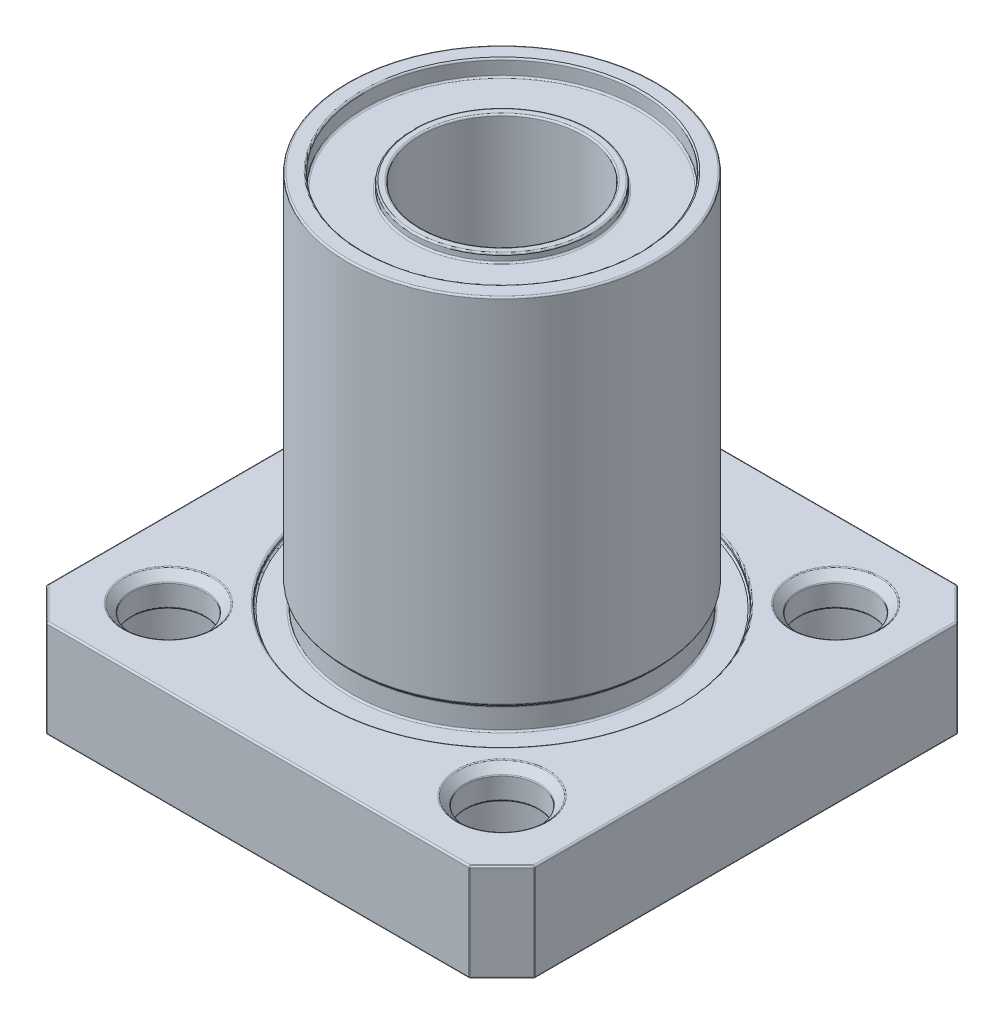
from build123d import *

# Parameters (mm, degrees)
SKETCH1_W           = 30
SKETCH1_H           = 30
BOSS_EXTRUDE1_DEPTH = 6
SKETCH2_R           = 9.5
BOSS_EXTRUDE2_DEPTH = 23
CUT_EXTRUDE3_REACH  = 33.289
SKETCH3_R           = 2.25
CHAMFER2_SIZE       = 2
SKETCH6_R           = 8.5
CUT_EXTRUDE4_DEPTH  = 36.930488446
CUT_EXTRUDE6_START  = -0.3
SKETCH7_R           = 10.8
SKETCH7_R_2         = 9.5
CUT_EXTRUDE6_DEPTH  = 0.3
SKETCH9_R           = 8.5
SKETCH9_R_2         = 5
BOSS_EXTRUDE3_DEPTH = 27
BOSS_EXTRUDE4_START = 0.5
SKETCH10_R          = 5.5
SKETCH10_R_2        = 5
BOSS_EXTRUDE4_DEPTH = 0.5
CHAMFER3_SIZE       = 0.5
SKETCH12_R          = 3.75
CUT_EXTRUDE7_DEPTH  = 4.1
FILLET2_R           = 0.1
CHAMFER4_SIZE       = 0.5


with BuildPart() as part:
    # Sketch1 → Boss-Extrude1 (new body)
    with BuildSketch(Plane(origin=(0, 0, 0), x_dir=(1, 0, 0), z_dir=(0, 1, 0))):
        Rectangle(SKETCH1_W, SKETCH1_H)
    extrude(amount=BOSS_EXTRUDE1_DEPTH)

    # Sketch2 → Boss-Extrude2 (add)
    with BuildSketch(Plane(origin=(0, 6, 0), x_dir=(1, 0, 0), z_dir=(0, 1, 0))):
        Circle(SKETCH2_R)
    extrude(amount=BOSS_EXTRUDE2_DEPTH)

    # Sketch3 → Cut-Extrude3 (cut, up to next)
    with BuildSketch(Plane(origin=(0, 6, 0), x_dir=(1, 0, 0), z_dir=(0, 1, 0)), mode=Mode.PRIVATE) as cut_extrude3_sk1:
        with Locations((-10.253048327, 10.253048327)):
            Circle(SKETCH3_R)
    cut_extrude3_tool1 = extrude(cut_extrude3_sk1.sketch, amount=-CUT_EXTRUDE3_REACH, mode=Mode.PRIVATE) & part.part
    # Sketch3 → Cut-Extrude3 (cut, up to next)
    with BuildSketch(Plane(origin=(0, 6, 0), x_dir=(1, 0, 0), z_dir=(0, 1, 0)), mode=Mode.PRIVATE) as cut_extrude3_sk2:
        with Locations((10.253048327, 10.253048327)):
            Circle(SKETCH3_R)
    cut_extrude3_tool2 = extrude(cut_extrude3_sk2.sketch, amount=-CUT_EXTRUDE3_REACH, mode=Mode.PRIVATE) & part.part
    # Sketch3 → Cut-Extrude3 (cut, up to next)
    with BuildSketch(Plane(origin=(0, 6, 0), x_dir=(1, 0, 0), z_dir=(0, 1, 0)), mode=Mode.PRIVATE) as cut_extrude3_sk3:
        with Locations((10.253048327, -10.253048327)):
            Circle(SKETCH3_R)
    cut_extrude3_tool3 = extrude(cut_extrude3_sk3.sketch, amount=-CUT_EXTRUDE3_REACH, mode=Mode.PRIVATE) & part.part
    # Sketch3 → Cut-Extrude3 (cut, up to next)
    with BuildSketch(Plane(origin=(0, 6, 0), x_dir=(1, 0, 0), z_dir=(0, 1, 0)), mode=Mode.PRIVATE) as cut_extrude3_sk4:
        with Locations((-10.253048327, -10.253048327)):
            Circle(SKETCH3_R)
    cut_extrude3_tool4 = extrude(cut_extrude3_sk4.sketch, amount=-CUT_EXTRUDE3_REACH, mode=Mode.PRIVATE) & part.part
    add(cut_extrude3_tool1.solids().sort_by_distance((-10.253048, 6, -10.253048))[0], mode=Mode.SUBTRACT)
    add(cut_extrude3_tool2.solids().sort_by_distance((10.253048, 6, -10.253048))[0], mode=Mode.SUBTRACT)
    add(cut_extrude3_tool3.solids().sort_by_distance((10.253048, 6, 10.253048))[0], mode=Mode.SUBTRACT)
    add(cut_extrude3_tool4.solids().sort_by_distance((-10.253048, 6, 10.253048))[0], mode=Mode.SUBTRACT)

    # Chamfer2
    chamfer2_edges = [part.edges().sort_by_distance(p)[0] for p in [
        (15, 3, -15),
        (15, 3, 15),
        (-15, 3, 15),
        (-15, 3, -15),
    ]]
    chamfer(chamfer2_edges, length=CHAMFER2_SIZE)

    # Sketch6 → Cut-Extrude4 (cut, through all)
    with BuildSketch(Plane(origin=(0, 29, 0), x_dir=(1, 0, 0), z_dir=(0, 1, 0))):
        Circle(SKETCH6_R)
    extrude(amount=-CUT_EXTRUDE4_DEPTH, mode=Mode.SUBTRACT)

    # Sketch7 → Cut-Extrude6 (cut)
    with BuildSketch(Plane(origin=(0, 6, 0), x_dir=(1, 0, 0), z_dir=(0, 1, 0)).offset(CUT_EXTRUDE6_START)):
        Circle(SKETCH7_R)
        Circle(SKETCH7_R_2, mode=Mode.SUBTRACT)
    extrude(amount=CUT_EXTRUDE6_DEPTH, mode=Mode.SUBTRACT)

    # Sketch8 → Cut-Revolve1 (revolve, cut)
    with BuildSketch(Plane.XY):
        Polygon((-9.5, 7.3), (-9.5, 5.7), (-9.25, 5.7), (-9.25, 7.05), align=None)
    revolve(axis=Axis((0, 29, 0), (0, -1, 0)), mode=Mode.SUBTRACT)

    # Sketch9 → Boss-Extrude3 (add)
    with BuildSketch(Plane(origin=(0, 28, 0), x_dir=(1, 0, 0), z_dir=(0, 1, 0))):
        Circle(SKETCH9_R)
        Circle(SKETCH9_R_2, mode=Mode.SUBTRACT)
    extrude(amount=-BOSS_EXTRUDE3_DEPTH)

    # Sketch10 → Boss-Extrude4 (add)
    with BuildSketch(Plane(origin=(0, 28, 0), x_dir=(1, 0, 0), z_dir=(0, 1, 0)).offset(BOSS_EXTRUDE4_START)):
        Circle(SKETCH10_R)
        Circle(SKETCH10_R_2, mode=Mode.SUBTRACT)
    extrude(amount=-BOSS_EXTRUDE4_DEPTH)

    # Chamfer3
    chamfer3_edges = [part.edges().sort_by_distance(p)[0] for p in [
        (8.003048327, 6, 10.253048327),
        (8.003048327, 6, -10.253048327),
        (-12.503048327, 6, 10.253048327),
        (-12.503048327, 6, -10.253048327),
    ]]
    chamfer(chamfer3_edges, length=CHAMFER3_SIZE)

    # Sketch12 → Cut-Extrude7 (cut)
    with BuildSketch(Plane.XZ):
        with Locations((-10.253048327, 10.253048327)):
            Circle(SKETCH12_R)
        with Locations((10.253048327, 10.253048327)):
            Circle(SKETCH12_R)
        with Locations((-10.253048327, -10.253048327)):
            Circle(SKETCH12_R)
        with Locations((10.253048327, -10.253048327)):
            Circle(SKETCH12_R)
    extrude(amount=-CUT_EXTRUDE7_DEPTH, mode=Mode.SUBTRACT)

    # Fillet2
    fillet2_edges = [part.edges().sort_by_distance(p)[0] for p in [
        (-8.5, 1, 0),
        (-15, 0, 0),
        (14, 0, 14),
        (15, 3, 13),
        (15, 0, 0),
        (14, 0, -14),
        (15, 3, -13),
        (0, 0, -15),
        (13, 3, -15),
        (-15, 3, -13),
        (-14, 0, -14),
        (-13, 3, -15),
        (-14, 0, 14),
        (-15, 3, 13),
        (-13, 3, 15),
        (13, 3, 15),
        (0, 0, 15),
        (-12.503048327, 4.1, -10.253048327),
        (-12.503048327, 5.5, -10.253048327),
        (8.003048327, 4.1, 10.253048327),
        (8.003048327, 5.5, 10.253048327),
        (-12.503048327, 4.1, 10.253048327),
        (-12.503048327, 5.5, 10.253048327),
        (8.003048327, 4.1, -10.253048327),
        (8.003048327, 5.5, -10.253048327),
        (14, 6, 14),
        (0, 6, 15),
        (-14, 6, 14),
        (-15, 6, 0),
        (-14, 6, -14),
        (0, 6, -15),
        (14, 6, -14),
        (15, 6, 0),
        (-10.8, 6, 0),
        (-13.003048327, 6, -10.253048327),
        (-13.003048327, 6, 10.253048327),
        (7.503048327, 6, -10.253048327),
        (7.503048327, 6, 10.253048327),
        (-10.8, 5.7, 0),
        (0, 7.3, 9.5),
        (9.25, 5.7, 0),
        (9.25, 7.05, 0),
        (-9.5, 29, 0),
        (-8.5, 29, 0),
        (-5.5, 28, 0),
        (-8.5, 28, 0),
        (-5.5, 28.5, 0),
        (-5, 28.5, 0),
        (-8.5, 0, 0),
    ]]
    fillet(fillet2_edges, radius=FILLET2_R)

    # Chamfer4
    chamfer4_edges = [part.edges().sort_by_distance(p)[0] for p in [
        (-14.003048327, 0, -10.253048327),
        (6.503048327, 0, -10.253048327),
        (6.503048327, 0, 10.253048327),
        (-14.003048327, 0, 10.253048327),
    ]]
    chamfer(chamfer4_edges, length=CHAMFER4_SIZE)


solid = part.part
